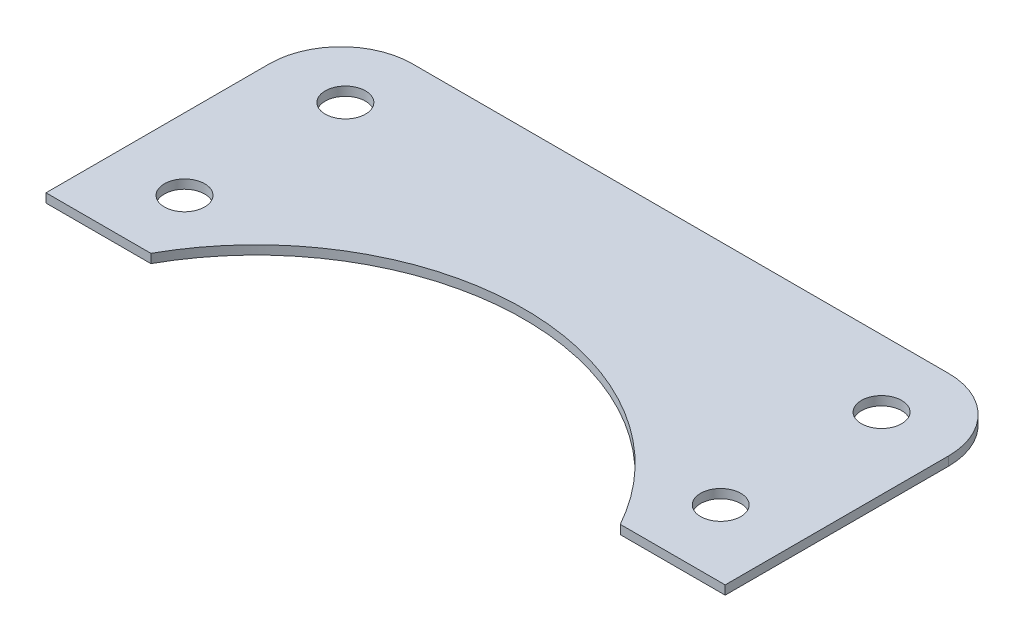
from build123d import *

# Parameters (mm, degrees)
SKETCH1_R           = 14.3129
SKETCH1_R_2         = 14.3256
BOSS_EXTRUDE1_DEPTH = 6.35
FILLET1_R           = 50.8


with BuildPart() as part:
    # Sketch1 → Boss-Extrude1 (new body)
    with BuildSketch(Plane(origin=(0, 0, 0), x_dir=(1, 0, 0), z_dir=(0, 1, 0))):
        with BuildLine():
            Line((241.3, 104.775), (-241.3, 104.775))
            Line((-241.3, 104.775), (-241.3, -104.775))
            Line((-241.3, -104.775), (-166.770634031, -104.775))
            ThreePointArc((-166.770634031, -104.775), (0, -6.35), (166.770634031, -104.775))
            Line((166.770634031, -104.775), (241.3, -104.775))
            Line((241.3, -104.775), (241.3, 104.775))
        make_face()
        with Locations((-190.5, -57.15)):
            Circle(SKETCH1_R, mode=Mode.SUBTRACT)
        with Locations((-190.5, 57.15)):
            Circle(SKETCH1_R_2, mode=Mode.SUBTRACT)
        with Locations((190.5, -57.15)):
            Circle(SKETCH1_R, mode=Mode.SUBTRACT)
        with Locations((190.5, 57.15)):
            Circle(SKETCH1_R_2, mode=Mode.SUBTRACT)
    extrude(amount=BOSS_EXTRUDE1_DEPTH)

    # Fillet1
    fillet1_edges = [part.edges().sort_by_distance(p)[0] for p in [
        (241.3, 3.175, -104.775),
        (-241.3, 3.175, -104.775),
    ]]
    fillet(fillet1_edges, radius=FILLET1_R)


solid = part.part
